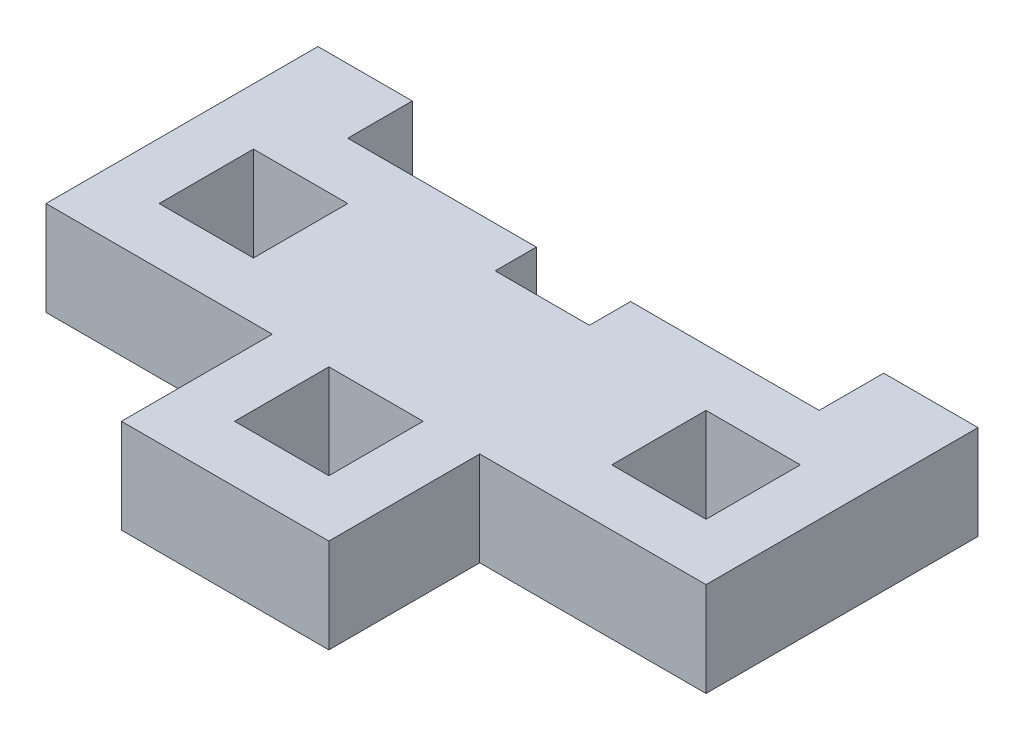
from build123d import *

# Parameters (mm, degrees)
SKETCH1_W           = 6.35
SKETCH1_H           = 6.35
BOSS_EXTRUDE1_DEPTH = 6.35


with BuildPart() as part:
    # Sketch1 → Boss-Extrude1 (new body)
    with BuildSketch(Plane(origin=(0, 0, 0), x_dir=(1, 0, 0), z_dir=(0, 1, 0))):
        Polygon((-22.225, -6.985), (-6.985, -6.985), (-6.985, -17.145), (6.985, -17.145), (6.985, -6.985), (22.225, -6.985), (22.225, 6.985), (22.225, 11.329999946), (15.875, 11.329999946), (15.875, 6.985), (3.175, 6.985), (3.175, 4.212499957), (-3.175, 4.212499957), (-3.175, 6.985), (-15.875, 6.985), (-15.875, 11.329999946), (-22.225, 11.329999946), (-22.225, 6.985), align=None)
        with Locations((0, -10.16)):
            Rectangle(SKETCH1_W, SKETCH1_H, mode=Mode.SUBTRACT)
        with Locations((15.24, 0)):
            Rectangle(SKETCH1_W, SKETCH1_H, mode=Mode.SUBTRACT)
        with Locations((-15.24, 0)):
            Rectangle(SKETCH1_W, SKETCH1_H, mode=Mode.SUBTRACT)
    extrude(amount=BOSS_EXTRUDE1_DEPTH)


solid = part.part
